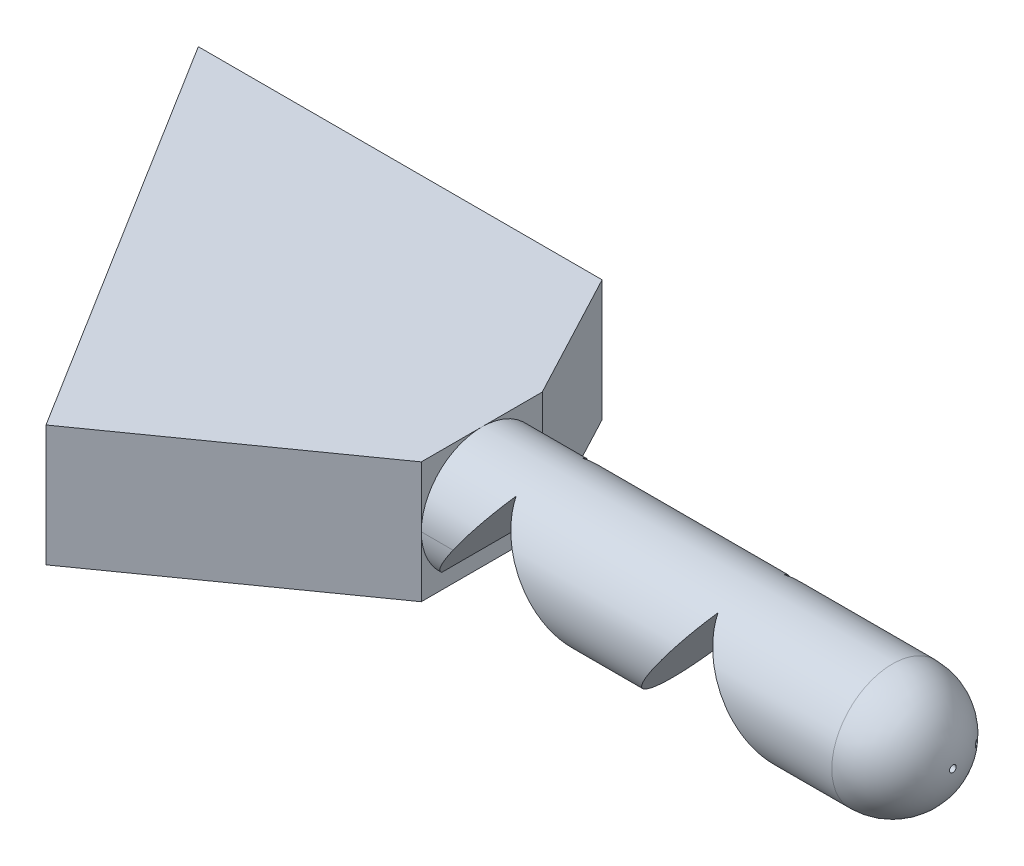
from build123d import *

# Parameters (mm, degrees)
SKETCH1_W                    = 70
SKETCH1_H                    = 9
FILLET1_R                    = 9
CUT_EXTRUDE1_DEPTH           = 15
SKETCH4_R                    = 0.2
CUT_EXTRUDE2_DEPTH           = 73.835430939
SKETCH5_R                    = 0.5
CUT_EXTRUDE3_DEPTH           = 5
CUT_EXTRUDE3_DRAFT           = -3
CUT_EXTRUDE3_PROFILE_2_DEPTH = 5
CUT_EXTRUDE3_PROFILE_2_DRAFT = -3
BOSS_EXTRUDE1_DEPTH          = 18


with BuildPart() as part:
    # Sketch1 → Revolve1 (revolve)
    with BuildSketch(Plane.XY):
        with Locations((35, 4.5)):
            Rectangle(SKETCH1_W, SKETCH1_H)
    revolve(axis=Axis((0, 9, 0), (1, 0, 0)))

    # Fillet1
    fillet1_edges = [part.edges().sort_by_distance(p)[0] for p in [
        (70, 18, 0),
    ]]
    fillet(fillet1_edges, radius=FILLET1_R)

    # Sketch2 → Cut-Extrude1 (cut, symmetric)
    with BuildSketch(Plane.XY):
        Polygon((-1.583487195, 0), (21.583487195, 0), (10, 16.542934148), align=None)
        Polygon((40, 16.542934148), (28.416512805, 0), (51.583487195, 0), align=None)
    extrude(amount=CUT_EXTRUDE1_DEPTH, both=True, mode=Mode.SUBTRACT)

    # Sketch4 → Cut-Extrude2 (cut, through all)
    with BuildSketch(Plane.ZY):
        with Locations((0, 9)):
            Circle(SKETCH4_R)
        with Locations((-5, 9)):
            Circle(SKETCH4_R)
    extrude(amount=-CUT_EXTRUDE2_DEPTH, mode=Mode.SUBTRACT)


with BuildPart() as cut_extrude3_tool:
    # Sketch5 → Cut-Extrude3 (with draft: the straight prism first)
    with BuildSketch(Plane(origin=(69.997777503, 0, 0), x_dir=(0, 0, -1), z_dir=(1, 0, 0))):
        with Locations((0, 9)):
            Circle(SKETCH5_R)
    extrude(amount=-CUT_EXTRUDE3_DEPTH)
    # Cut-Extrude3: the draft: its side faces are tilted about the plane it starts from
    cut_extrude3_sides = [cut_extrude3_tool.faces().sort_by_distance(p)[0] for p in [
        (67.497777503, 9, 0.5),
    ]]
    draft(cut_extrude3_sides, Plane(origin=(69.997777503, 0, 0), x_dir=(0, 0, -1), z_dir=(1, 0, 0)), CUT_EXTRUDE3_DRAFT)


with BuildPart() as part_1:
    add(part.part)

    # Cut-Extrude3: cut by cut_extrude3_tool
    add(cut_extrude3_tool.part, mode=Mode.SUBTRACT)


with BuildPart() as cut_extrude3_profile_2_tool:
    # Sketch5 → Cut-Extrude3 profile 2 (with draft: the straight prism first)
    with BuildSketch(Plane(origin=(69.997777503, 0, 0), x_dir=(0, 0, -1), z_dir=(1, 0, 0))):
        with Locations((5, 9)):
            Circle(SKETCH5_R)
    extrude(amount=-CUT_EXTRUDE3_PROFILE_2_DEPTH)
    # Cut-Extrude3 profile 2: the draft: its side faces are tilted about the plane it starts from
    cut_extrude3_profile_2_sides = [cut_extrude3_profile_2_tool.faces().sort_by_distance(p)[0] for p in [
        (67.497777503, 9, -4.5),
    ]]
    draft(cut_extrude3_profile_2_sides, Plane(origin=(69.997777503, 0, 0), x_dir=(0, 0, -1), z_dir=(1, 0, 0)), CUT_EXTRUDE3_PROFILE_2_DRAFT)


with BuildPart() as part_2:
    add(part_1.part)

    # Cut-Extrude3 profile 2: cut by cut_extrude3_profile_2_tool
    add(cut_extrude3_profile_2_tool.part, mode=Mode.SUBTRACT)

    # Sketch6 → Boss-Extrude1 (add)
    with BuildSketch(Plane(origin=(0, 0, 0), x_dir=(1, 0, 0), z_dir=(0, 1, 0))):
        Polygon((-32.63196001, -32.133421406), (0, -9), (0, 8.974742091), (-10, 27.866578594), (-70, 27.866578594), align=None)
    extrude(amount=BOSS_EXTRUDE1_DEPTH)


solid = part_2.part
